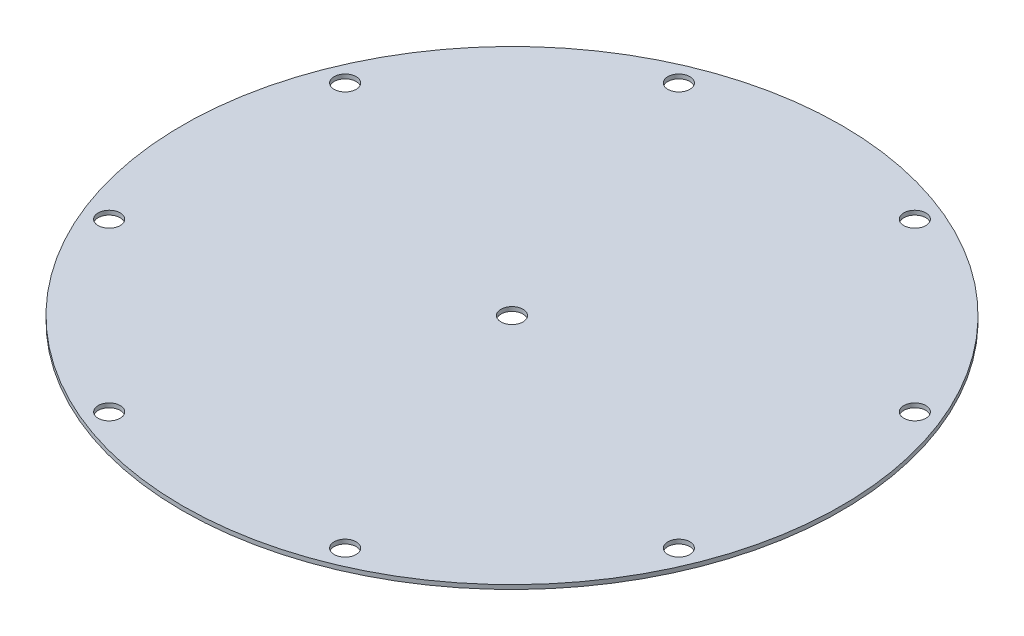
from build123d import *

# Parameters (mm, degrees)
SKETCH2_W                  = 77.55
SKETCH2_H                  = 1
F_6_0_204_DIAMETER_HOLE1_D = 5.1816
CIRPATTERN3_COUNT          = 8
F_6_0_204_DIAMETER_HOLE2_D = 5.1816


with BuildPart() as part:
    # Sketch2 → Revolve1 (revolve)
    with BuildSketch(Plane(origin=(0, 0, 0), x_dir=(0, 0, -1), z_dir=(1, 0, 0))):
        with Locations((-38.775, 0.5)):
            Rectangle(SKETCH2_W, SKETCH2_H)
    revolve(axis=Axis((0, -0.05, 0), (0, 1, 0)))

    # #6 (0.204) Diameter Hole1 (through all)
    with Locations(Plane(origin=(0, 1, 0), x_dir=(1, 0, 0), z_dir=(0, 1, 0))):
        with Locations((-27.763683018, 67.027460084)):
            f_6_0_204_diameter_hole1 = Hole(F_6_0_204_DIAMETER_HOLE1_D / 2)

    # CirPattern3: #6 (0.204) Diameter Hole1 ×8 about axis
    cirpattern3_axis = Axis((0, -0.05, 0), (0, 1, 0))
    for i in range(1, CIRPATTERN3_COUNT):
        add(f_6_0_204_diameter_hole1.rotate(cirpattern3_axis, i * 360 / CIRPATTERN3_COUNT), mode=Mode.SUBTRACT)

    # #6 (0.204) Diameter Hole2 (through all)
    with Locations(Plane(origin=(0, 1, 0), x_dir=(1, 0, 0), z_dir=(0, 1, 0))):
        with Locations((0, 0)):
            Hole(F_6_0_204_DIAMETER_HOLE2_D / 2)


solid = part.part
